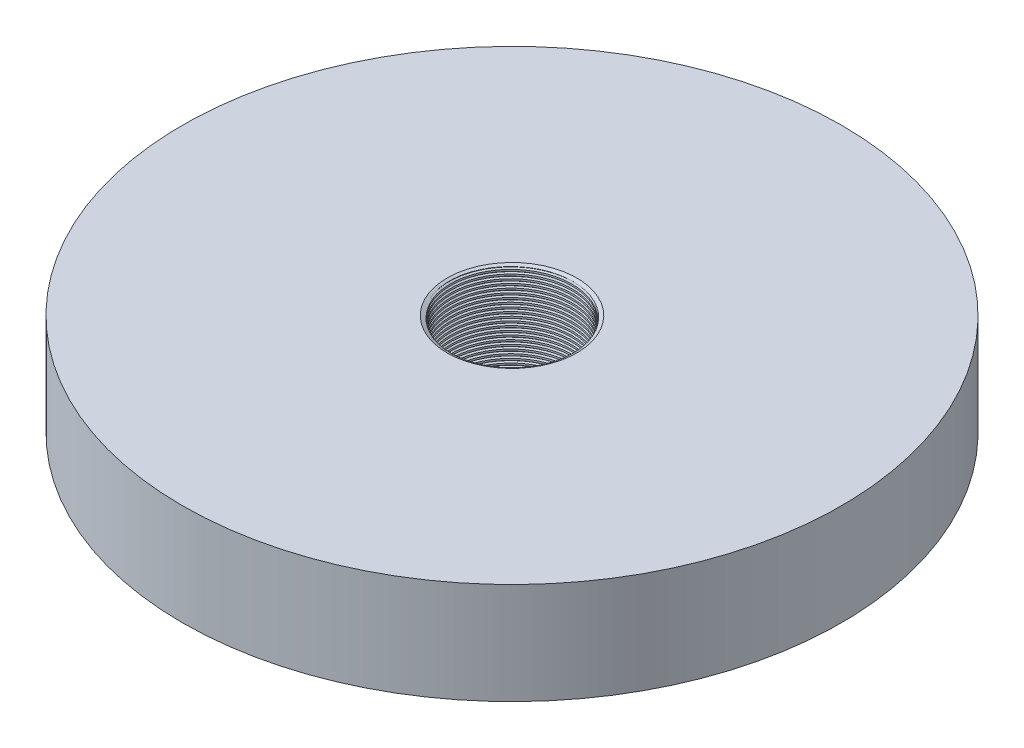
from build123d import *

# Parameters (mm, degrees)
SKETCH1_R           = 162.5
SKETCH1_R_2         = 30
BOSS_EXTRUDE1_DEPTH = 25
CHAMFER1_SIZE       = 2
CHAMFER1_SIZE2      = 1.154700538
THREAD1_PITCH       = 2


with BuildPart() as part:
    # Sketch1 → Boss-Extrude1 (new, symmetric)
    with BuildSketch(Plane(origin=(0, 0, 0), x_dir=(1, 0, 0), z_dir=(0, 1, 0))):
        with Locations(Location((0, 0, 0), (0, 0, 270))):
            Circle(SKETCH1_R)
        with Locations(Location((0, 0, 0), (0, 0, 270))):
            Circle(SKETCH1_R_2, mode=Mode.SUBTRACT)
    extrude(amount=BOSS_EXTRUDE1_DEPTH, both=True)

    # Chamfer1
    chamfer1_edges = [part.edges().sort_by_distance(p)[0] for p in [
        (0, 25, -30),
    ]]
    chamfer1_side = [part.faces().sort_by_distance(p)[0] for p in [
        (0, 25, -157.903805922),
    ]]
    chamfer(chamfer1_edges, length=CHAMFER1_SIZE, length2=CHAMFER1_SIZE2, reference=chamfer1_side[0])

    # Thread1: arcs per turn and ends read off the stored shape
    # Thread1: the profile of Thread Profile2 profile screwed along a right-hand helix through 26.92265 turns, 10 arcs to a turn; built about Z, then put on its axis
    thread1_z = Axis((0, 0, 0), (0, 0, 1))
    thread1_corners = [(29.9997, 0, -0.000173205), (30.811898813, 0, 0.468749998), (30.811898813, 0, 0.656249998), (29.9997, 0, 1.125173201)]
    with BuildLine(mode=Mode.PRIVATE) as thread1_profile:
        Line(thread1_corners[0], thread1_corners[1])
        Line(thread1_corners[1], thread1_corners[2])
        Line(thread1_corners[2], thread1_corners[3])
        Line(thread1_corners[3], thread1_corners[0])
    thread1_cap = Face(thread1_profile.wire())
    thread1_turn_angles = [0, 18, 36, 54, 72, 90, 108, 126, 144, 162, 180, 198, 216, 234, 252, 270, 288, 306, 324, 342, 360]
    thread1_turn_weights = [1, 0.9510565162951535, 1, 0.9510565162951535, 1, 0.9510565162951535, 1, 0.9510565162951535, 1, 0.9510565162951535, 1, 0.9510565162951535, 1, 0.9510565162951535, 1, 0.9510565162951535, 1, 0.9510565162951535, 1, 0.9510565162951535, 1]
    thread1_turn_rails = [Edge.make_bspline([Vector(p[0], p[1], 0).rotate(thread1_z, thread1_turn_angles[k]) / thread1_turn_weights[k] + Vector(0, 0, p[2] + THREAD1_PITCH * thread1_turn_angles[k] / 360) for k in range(21)], [0, 0, 0, 1, 1, 2, 2, 3, 3, 4, 4, 5, 5, 6, 6, 7, 7, 8, 8, 9, 9, 10, 10, 10], 2, thread1_turn_weights) for p in thread1_corners]
    thread1_turn_sides = [Face.make_surface_from_curves(thread1_turn_rails[p[0]], thread1_turn_rails[p[1]]) for p in [(0, 1), (1, 2), (2, 3), (3, 0)]]
    thread1_last_angles = [9360, 9378, 9396, 9414, 9432, 9450, 9468, 9486, 9504, 9522, 9540, 9558, 9576, 9594, 9612, 9630, 9648, 9666, 9684, 9688.076951546, 9692.153903092]
    thread1_last_weights = [1, 0.9510565162951535, 1, 0.9510565162951535, 1, 0.9510565162951535, 1, 0.9510565162951535, 1, 0.9510565162951535, 1, 0.9510565162951535, 1, 0.9510565162951535, 1, 0.9510565162951535, 1, 0.9510565162951535, 1, 0.9974694636039874, 1]
    thread1_last_rails = [Edge.make_bspline([Vector(p[0], p[1], 0).rotate(thread1_z, thread1_last_angles[k]) / thread1_last_weights[k] + Vector(0, 0, p[2] + THREAD1_PITCH * thread1_last_angles[k] / 360) for k in range(21)], [0, 0, 0, 1, 1, 2, 2, 3, 3, 4, 4, 5, 5, 6, 6, 7, 7, 8, 8, 9, 9, 10, 10, 10], 2, thread1_last_weights) for p in thread1_corners]
    thread1_last_sides = [Face.make_surface_from_curves(thread1_last_rails[p[0]], thread1_last_rails[p[1]]) for p in [(0, 1), (1, 2), (2, 3), (3, 0)]]
    thread1 = Plane(origin=(0, 28.845299462, 0), x_dir=(-1, 0, 0), z_dir=(0, -1, 0)) * Solid(Shell([*[p.moved(Location((0, 0, THREAD1_PITCH * i))) for i in range(26) for p in thread1_turn_sides], *thread1_last_sides, thread1_cap, thread1_cap.rotate(thread1_z, 9692.153903092).moved(Location((0, 0, THREAD1_PITCH * 9692.153903092 / 360)))]))
    add(thread1, mode=Mode.SUBTRACT)

    # Chamfer2: read off the stored shape, not the designer's step
    # Chamfer2 outline → Chamfer2 (revolve, cut)
    with BuildSketch(Plane.XY):
        Polygon((33.464101615, -25), (30, -23), (30, -25), align=None)
    revolve(axis=Axis((0, 0, 0), (0, 1, 0)), mode=Mode.SUBTRACT)


solid = part.part
